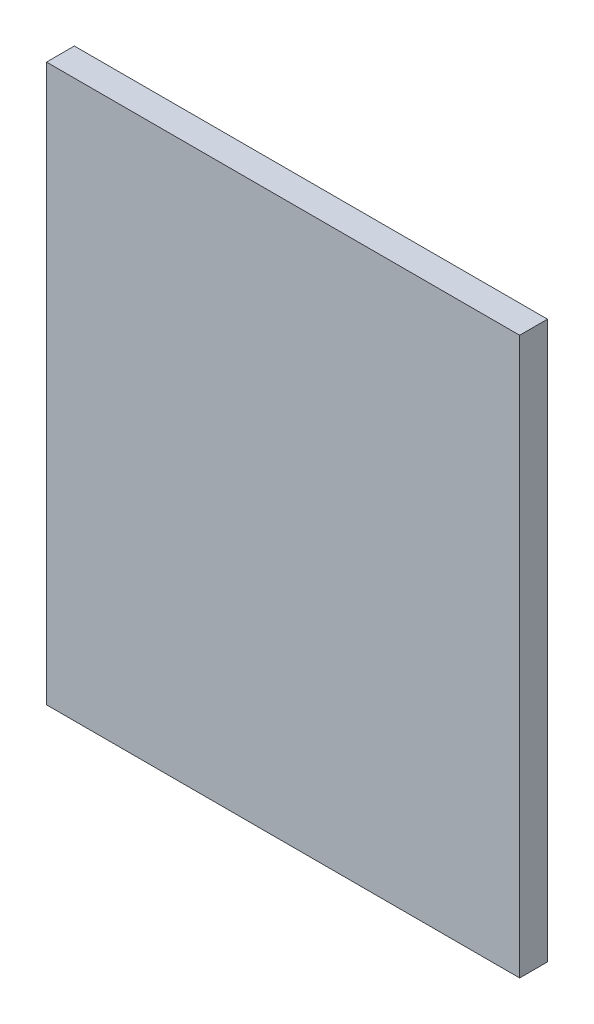
from build123d import *

# Parameters (mm, degrees)
SKETCH1_W                 = 170
SKETCH1_H                 = 200
BOTTOM_OUTER_CASING_DEPTH = 10


with BuildPart() as part:
    # Sketch1 → Bottom Outer Casing (new body)
    with BuildSketch(Plane.XY):
        with Locations((85, 100)):
            Rectangle(SKETCH1_W, SKETCH1_H)
    extrude(amount=BOTTOM_OUTER_CASING_DEPTH)


solid = part.part
